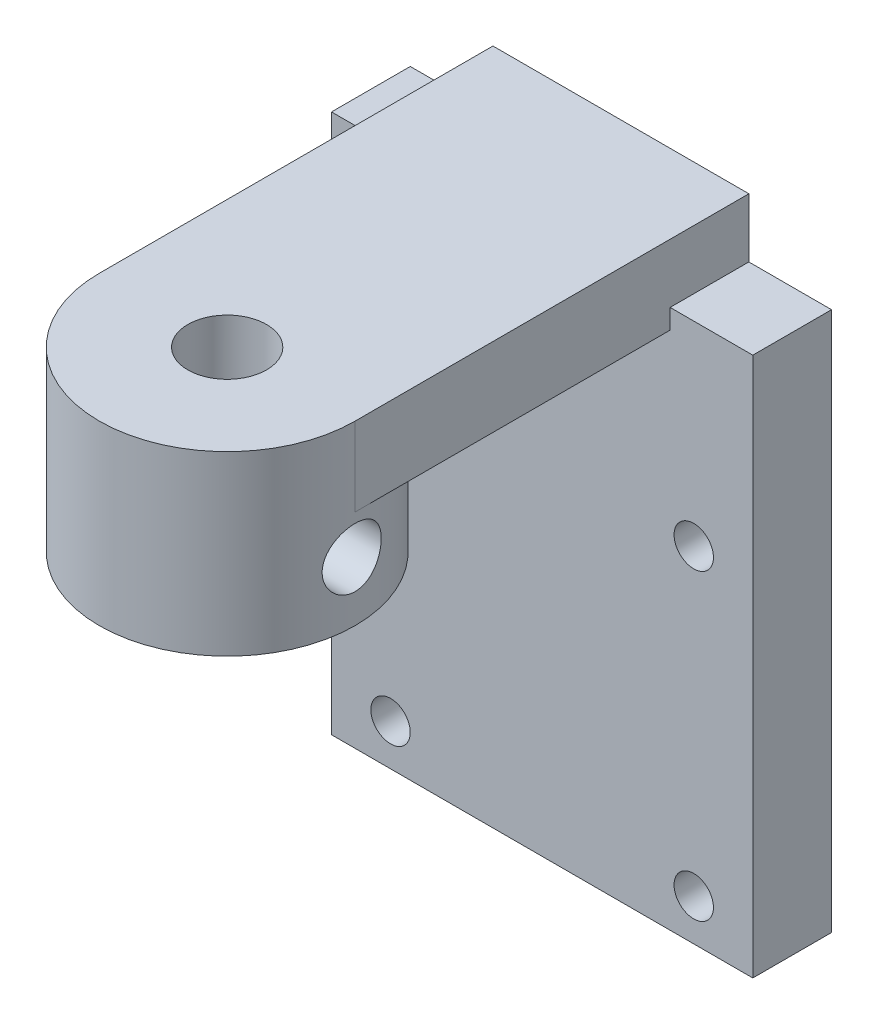
from build123d import *

# Parameters (mm, degrees)
SKETCH_2_R                = 6.5
EXTRUDE_1_DEPTH           = 9
SKETCH_3_R                = 2
CUT_EXTRUDE_2_DEPTH       = 13.86468033
EXTRUDE_START             = -4
EXTRUDE_2_DEPTH           = 4
EXTRUDE_6_DEPTH           = 4
SKETCH_17_R               = 1
CUT_EXTRUDE_11_DEPTH      = 4
CUT_EXTRUDE_12_DEPTH      = 32.18413058
CUT_EXTRUDE_12_DEPTH_BACK = 32.18413058
SKETCH_20_R               = 1.5


with BuildPart() as part:
    # 草图2 → 凸台-拉伸1 (new body)
    with BuildSketch(Plane(origin=(0, 0, 0), x_dir=(1, 0, 0), z_dir=(0, 1, 0))):
        Circle(SKETCH_2_R)
    extrude(amount=EXTRUDE_1_DEPTH)

    # 草图3 → 切除-拉伸2 (cut, through all)
    with BuildSketch(Plane(origin=(0, 9, 0), x_dir=(1, 0, 0), z_dir=(0, 1, 0))):
        Circle(SKETCH_3_R)
    extrude(amount=-CUT_EXTRUDE_2_DEPTH, mode=Mode.SUBTRACT)

    # 草图4 → 凸台-拉伸2 (add)
    with BuildSketch(Plane(origin=(0, 9, 0), x_dir=(1, 0, 0), z_dir=(0, 1, 0)).offset(EXTRUDE_START)):
        with BuildLine():
            Line((6.5, 0), (6.5, 20))
            Line((6.5, 20), (4, 20))
            Line((4, 20), (-4, 20))
            Line((-4, 20), (-6.5, 20))
            Line((-6.5, 20), (-6.5, 0))
            ThreePointArc((-6.5, 0), (0, 6.5), (6.5, 0))
        make_face()
    extrude(amount=EXTRUDE_2_DEPTH)

    # 草图6 → 凸台-拉伸6 (add)
    with BuildSketch(Plane(origin=(0, 0, -20), x_dir=(-1, 0, 0), z_dir=(0, 0, -1))):
        Polygon((10.7, -14.240758791), (10.7, 6), (6.5, 6), (-10.7, 6), (-10.7, -21.4), (10.7, -21.4), align=None)
    extrude(amount=-EXTRUDE_6_DEPTH)

    # 草图17 → 切除-拉伸11 (cut)
    with BuildSketch(Plane.XY.offset(-16)):
        with Locations((-7.7, -19.3)):
            Circle(SKETCH_17_R)
        with Locations((7.7, -19.3)):
            Circle(SKETCH_17_R)
        with Locations((7.7, -3.9)):
            Circle(SKETCH_17_R)
        with Locations((-7.7, -3.9)):
            Circle(SKETCH_17_R)
    extrude(amount=-CUT_EXTRUDE_11_DEPTH, mode=Mode.SUBTRACT)

    # 草图20 → 切除-拉伸12 (cut, two sides: drawn at the far end of the back side and taken through both)
    with BuildSketch(Plane(origin=(0, 0, 0), x_dir=(0, 0, -1), z_dir=(1, 0, 0)).offset(-CUT_EXTRUDE_12_DEPTH_BACK)):
        with Locations((0, 3)):
            Circle(SKETCH_20_R)
    extrude(amount=CUT_EXTRUDE_12_DEPTH + CUT_EXTRUDE_12_DEPTH_BACK, mode=Mode.SUBTRACT)


solid = part.part
